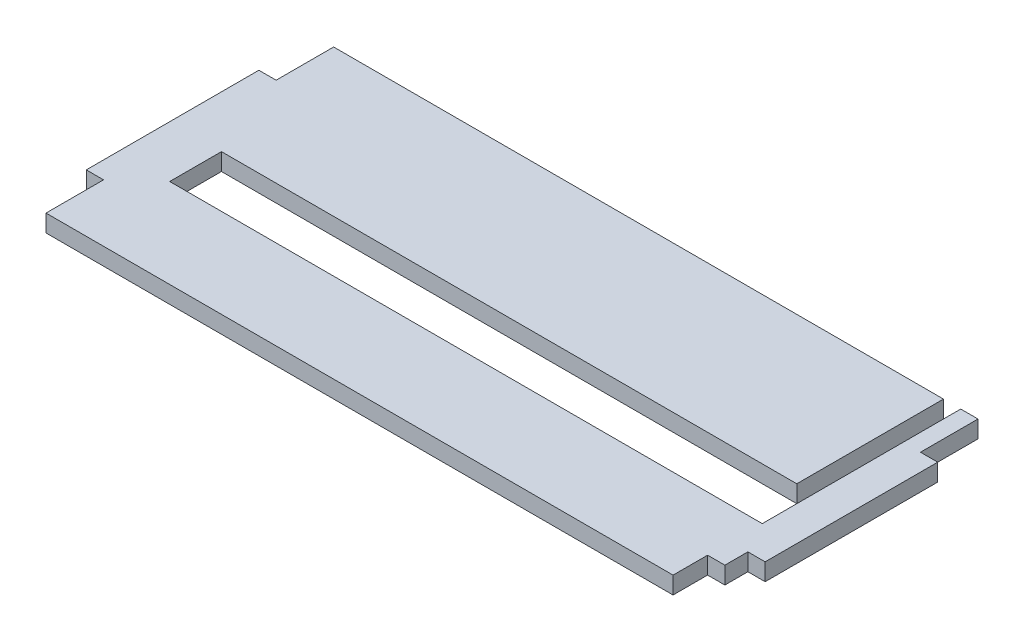
from build123d import *

# Parameters (mm, degrees)
LED_1_START         = 100
LED_1_OUTLINE_W     = 112
LED_1_OUTLINE_H     = 3
LED_1_DEPTH         = 25.5
LED_1_START_2       = 134.5
LED_1_2_OUTLINE_W   = 108.998029847
LED_1_2_OUTLINE_H   = 3
LED_1_2_DEPTH       = 15.5
LED_1_START_3       = 110
LED_1_3_OUTLINE_W   = 9
LED_1_3_OUTLINE_H   = 3
LED_1_3_DEPTH       = 30
LED_1_START_4       = 140
LED_1_4_OUTLINE_W   = 3.001970153
LED_1_4_OUTLINE_H   = 3
LED_1_4_DEPTH       = 4
SKETCH_1_W          = 3
SKETCH_1_H          = 34.5
CUT_EXTRUDE_1_DEPTH = 3


# Read off the part's stored shape, not the designer's step: 基体零件-LED限位板-1
with BuildPart() as part:
    # 基体零件-LED限位板-1 outline → 基体零件-LED限位板-1 (new body)
    with BuildSketch(Plane.XY.offset(LED_1_START)):
        with Locations((-59, 1.5)):
            Rectangle(LED_1_OUTLINE_W, LED_1_OUTLINE_H)
    extrude(amount=LED_1_DEPTH)



with BuildPart() as body_2:
    # LED_-1 2 outline → LED_-1 2 (new body)
    with BuildSketch(Plane.XY.offset(LED_1_START_2)):
        with Locations((-60.500985077, 1.5)):
            Rectangle(LED_1_2_OUTLINE_W, LED_1_2_OUTLINE_H)
    extrude(amount=LED_1_2_DEPTH)


with BuildPart() as part_1:
    add(part.part)

    add(body_2.part)  # LED_-1 3 merges body 2
    # LED_-1 3 outline → LED_-1 3 (add)
    with BuildSketch(Plane.XY.offset(LED_1_START_3)):
        with Locations((-113.5, 1.5)):
            Rectangle(LED_1_3_OUTLINE_W, LED_1_3_OUTLINE_H)
        with Locations((-4.5, 1.5)):
            Rectangle(LED_1_3_OUTLINE_W, LED_1_3_OUTLINE_H)
    extrude(amount=LED_1_3_DEPTH)

    # LED_-1 4 outline → LED_-1 4 (add)
    with BuildSketch(Plane.XY.offset(LED_1_START_4)):
        with Locations((-4.500985077, 1.5)):
            Rectangle(LED_1_4_OUTLINE_W, LED_1_4_OUTLINE_H)
    extrude(amount=LED_1_4_DEPTH)

    # 草图1 → 切除-拉伸1 (cut)
    with BuildSketch(Plane(origin=(0, 3, 0), x_dir=(1, 0, 0), z_dir=(0, 1, 0))):
        with Locations((-7.5, -117.25)):
            Rectangle(SKETCH_1_W, SKETCH_1_H)
    extrude(amount=-CUT_EXTRUDE_1_DEPTH, mode=Mode.SUBTRACT)


solid = part_1.part
